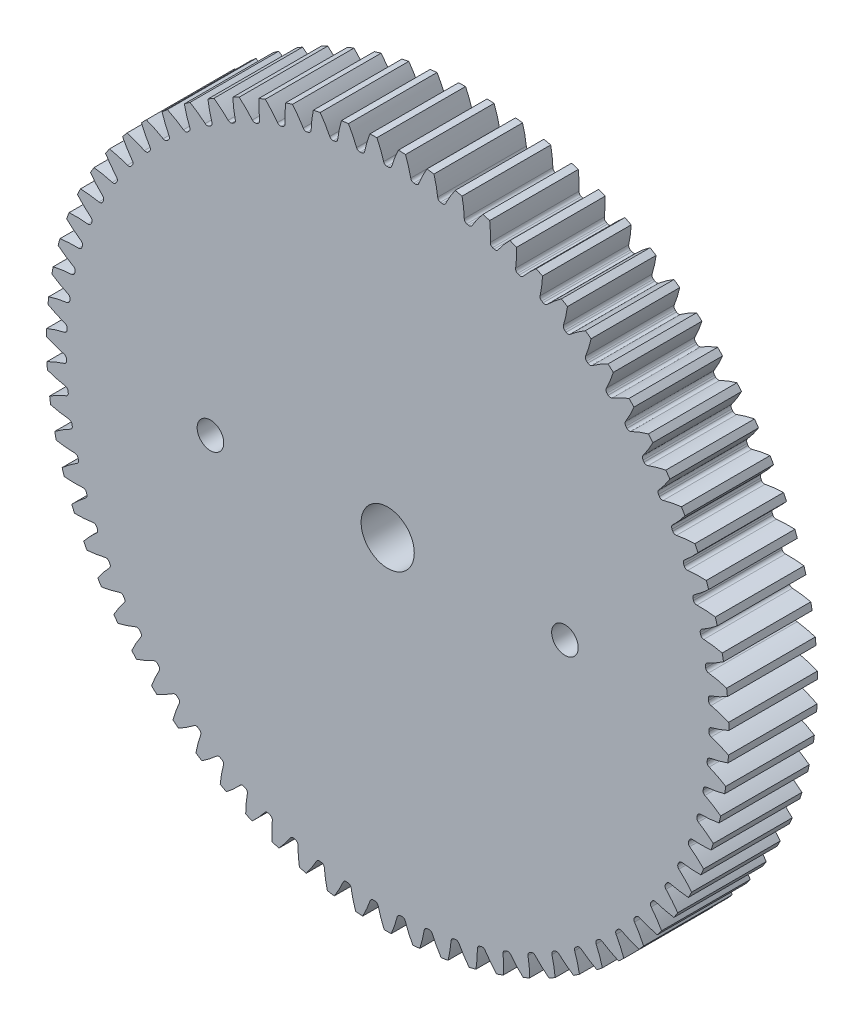
from build123d import *

# Parameters (mm, degrees)
SKETCH_1_R               = 38.5
LASHENA_DEPTH            = 10
CUT_EXTRUDEA_DEPTH       = 30
PATTERN_CIRCULAR_1_COUNT = 75
SKETCH_3_R               = 3
SKETCH_3_R_2             = 1.5
CUT_EXTRUDE_2_DEPTH      = 10


with BuildPart() as part:
    # 草图1 → LaShenA (new body)
    with BuildSketch(Plane.XY):
        Circle(SKETCH_1_R)
    extrude(amount=LASHENA_DEPTH)

    # SketchA → Cut-ExtrudeA (cut)
    with BuildSketch(Plane.XY.offset(10)):
        with BuildLine():
            ThreePointArc((0.091577355, 36.249884325), (0, 36.25), (-0.091577355, 36.249884325))
            ThreePointArc((-0.091577355, 36.249884325), (-0.320511841, 36.325863991), (-0.457587272, 36.524343801))
            add(Edge.make_bspline(
                [(-0.457587272, 36.524343801), (-0.460821953, 36.535532241), (-0.470382685, 36.568511471), (-0.486602543, 36.623768686), (-0.50675522, 36.690545595), (-0.527851198, 36.758788572), (-0.549927552, 36.828482717), (-0.573000874, 36.899619056), (-0.597093316, 36.972186691), (-0.622225365, 37.046174975), (-0.64841784, 37.121572911), (-0.67569134, 37.198369321), (-0.704066389, 37.276552799), (-0.733563399, 37.356111725), (-0.764202674, 37.437034264), (-0.796004408, 37.519308366), (-0.828988683, 37.602921767), (-0.863175466, 37.687861991), (-0.898584606, 37.77411635), (-0.935235836, 37.861671946), (-0.973148769, 37.950515671), (-1.012342893, 38.040634209), (-1.052837575, 38.132014036), (-1.094652053, 38.224641422), (-1.137805439, 38.318502432), (-1.182316714, 38.413582926), (-1.228204727, 38.509868562), (-1.275488195, 38.607344795), (-1.324185695, 38.705996882), (-1.391527659, 38.840080374), (-1.443465088, 38.940858442), (-1.478804602, 39.008300624)],
                knots=[0.096665642, 0.096665642, 0.096665642, 0.096665642, 0.108397743, 0.131255784, 0.154677173, 0.178661909, 0.203209993, 0.228321424, 0.253996203, 0.280234329, 0.307035802, 0.334400623, 0.362328792, 0.390820307, 0.41987517, 0.449493381, 0.479674939, 0.510419844, 0.541728097, 0.573599698, 0.606034645, 0.63903294, 0.672594583, 0.706719573, 0.74140791, 0.776659595, 0.812474627, 0.848853007, 0.885794734, 0.923299809, 1, 1, 1, 1], degree=3))
            ThreePointArc((-1.478804602, 39.008300624), (0, 39.0363213), (1.478804602, 39.008300624))
            add(Edge.make_bspline(
                [(0.457587272, 36.524343801), (0.460821953, 36.535532241), (0.470382685, 36.568511471), (0.486602543, 36.623768686), (0.50675522, 36.690545595), (0.527851198, 36.758788572), (0.549927552, 36.828482717), (0.573000874, 36.899619056), (0.597093316, 36.972186691), (0.622225365, 37.046174975), (0.64841784, 37.121572911), (0.67569134, 37.198369321), (0.704066389, 37.276552799), (0.733563399, 37.356111725), (0.764202674, 37.437034264), (0.796004408, 37.519308366), (0.828988683, 37.602921767), (0.863175466, 37.687861991), (0.898584606, 37.77411635), (0.935235836, 37.861671946), (0.973148769, 37.950515671), (1.012342893, 38.040634209), (1.052837575, 38.132014036), (1.094652053, 38.224641422), (1.137805439, 38.318502432), (1.182316714, 38.413582926), (1.228204727, 38.509868562), (1.275488195, 38.607344795), (1.324185695, 38.705996882), (1.391527659, 38.840080374), (1.443465088, 38.940858442), (1.478804602, 39.008300624)],
                knots=[0.096665642, 0.096665642, 0.096665642, 0.096665642, 0.108397743, 0.131255784, 0.154677173, 0.178661909, 0.203209993, 0.228321424, 0.253996203, 0.280234329, 0.307035802, 0.334400623, 0.362328792, 0.390820307, 0.41987517, 0.449493381, 0.479674939, 0.510419844, 0.541728097, 0.573599698, 0.606034645, 0.63903294, 0.672594583, 0.706719573, 0.74140791, 0.776659595, 0.812474627, 0.848853007, 0.885794734, 0.923299809, 1, 1, 1, 1], degree=3))
            ThreePointArc((0.457587272, 36.524343801), (0.320511841, 36.325863991), (0.091577355, 36.249884325))
        make_face()
    cut_extrudea = extrude(amount=-CUT_EXTRUDEA_DEPTH, mode=Mode.SUBTRACT)

    # 阵列(圆周)1: Cut-ExtrudeA ×75 about axis
    pattern_circular_1_axis = Axis((0, 0, -80.9), (0, 0, 1))
    for i in range(1, PATTERN_CIRCULAR_1_COUNT):
        add(cut_extrudea.rotate(pattern_circular_1_axis, i * 360 / PATTERN_CIRCULAR_1_COUNT), mode=Mode.SUBTRACT)

    # 草图3 → 切除-拉伸2 (cut)
    with BuildSketch(Plane.XY.offset(10)):
        Circle(SKETCH_3_R)
        with Locations((-20, 0)):
            Circle(SKETCH_3_R_2)
        with Locations((20, 0)):
            Circle(SKETCH_3_R_2)
    extrude(amount=-CUT_EXTRUDE_2_DEPTH, mode=Mode.SUBTRACT)


solid = part.part
